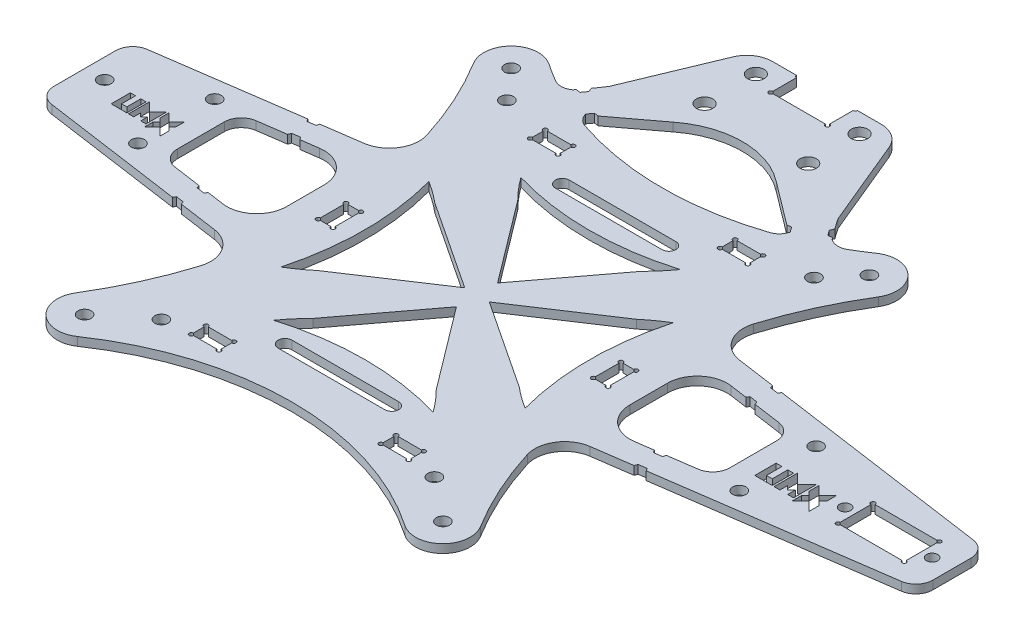
from build123d import *

# Parameters (mm, degrees)
SKETCH_1_R             = 1.55
SKETCH_1_R_2           = 1.3
SKETCH_1_W             = 6.5
SKETCH_1_H             = 3.5
SKETCH_1_W_2           = 3.5
SKETCH_1_H_2           = 6.5
SKETCH_1_W_3           = 15.5
SKETCH_1_H_3           = 8.2
EXTRUDE_1_DEPTH        = 2
FILLET_1_R             = 4
FILLET_2_R             = 7
SKETCH_4800_R          = 1.925
SKETCH_4800_R_2        = 1.55
EXTRUDE_2_DEPTH        = 2
CUT_EXTRUDE_7262_DEPTH = 139.317545525
SKETCH_10_R            = 0.5
CUT_EXTRUDE_7815_DEPTH = 139.317545525
FILLET_6_R             = 3.5
CUT_EXTRUDE_1_DEPTH    = 139.317545525


with BuildPart() as part:
    # 草图1 → 凸台-拉伸1 (new body)
    with BuildSketch(Plane(origin=(0, 0, 0), x_dir=(1, 0, 0), z_dir=(0, 1, 0))):
        with BuildLine():
            Line((111.35, 7.930343955), (111.35, -7.930343955))
            Line((111.35, -7.930343955), (36.25, -18.63611351))
            ThreePointArc((36.25, -18.63611351), (40.660213256, -33.120367866), (47.457481216, -46.649623332))
            ThreePointArc((47.457481216, -46.649623332), (46.417405741, -54.63634032), (38.389751701, -55.289161773))
            ThreePointArc((38.389751701, -55.289161773), (0, -43.436211003), (-38.389751701, -55.289161773))
            ThreePointArc((-38.389751701, -55.289161773), (-46.417405741, -54.63634032), (-47.457481216, -46.649623332))
            ThreePointArc((-47.457481216, -46.649623332), (-40.660213256, -33.120367866), (-36.25, -18.63611351))
            Line((-36.25, -18.63611351), (-91.953, -10.695454635))
            Line((-91.953, -10.695454635), (-91.953, 10.695454635))
            Line((-91.953, 10.695454635), (-36.25, 18.63611351))
            ThreePointArc((-36.25, 18.63611351), (-40.660213256, 33.120367866), (-47.457481216, 46.649623332))
            ThreePointArc((-47.457481216, 46.649623332), (-46.417405741, 54.63634032), (-38.389751701, 55.289161773))
            ThreePointArc((-38.389751701, 55.289161773), (0, 43.436211003), (38.389751701, 55.289161773))
            ThreePointArc((38.389751701, 55.289161773), (46.417405741, 54.63634032), (47.457481216, 46.649623332))
            ThreePointArc((47.457481216, 46.649623332), (40.660213256, 33.120367866), (36.25, 18.63611351))
            Line((36.25, 18.63611351), (111.35, 7.930343955))
        make_face()
        with Locations(Location((-36, 43, 0), (0, 0, 270))):
            Circle(SKETCH_1_R, mode=Mode.SUBTRACT)
        with Locations(Location((-32, -42, 0), (0, 0, 270))):
            Circle(SKETCH_1_R, mode=Mode.SUBTRACT)
        with Locations(Location((32, -42, 0), (0, 0, 90))):
            Circle(SKETCH_1_R, mode=Mode.SUBTRACT)
        with Locations(Location((36, 43, 0), (0, 0, 90))):
            Circle(SKETCH_1_R, mode=Mode.SUBTRACT)
        with Locations(Location((42, 50, 0), (0, 0, 270))):
            Circle(SKETCH_1_R, mode=Mode.SUBTRACT)
        with Locations(Location((42, -50, 0), (0, 0, 90))):
            Circle(SKETCH_1_R, mode=Mode.SUBTRACT)
        with Locations(Location((-42, -50, 0), (0, 0, 270))):
            Circle(SKETCH_1_R, mode=Mode.SUBTRACT)
        with Locations(Location((-42, 50, 0), (0, 0, 90))):
            Circle(SKETCH_1_R, mode=Mode.SUBTRACT)
        with Locations(Location((106.7, 0, 0), (0, 0, 270))):
            Circle(SKETCH_1_R_2, mode=Mode.SUBTRACT)
        with Locations(Location((86.3, 0, 0), (0, 0, 270))):
            Circle(SKETCH_1_R_2, mode=Mode.SUBTRACT)
        with Locations(Location((70.5, 9, 0), (0, 0, 270))):
            Circle(SKETCH_1_R, mode=Mode.SUBTRACT)
        with Locations(Location((70.5, -9, 0), (0, 0, 90))):
            Circle(SKETCH_1_R, mode=Mode.SUBTRACT)
        with Locations(Location((-70.5, -9, 0), (0, 0, 270))):
            Circle(SKETCH_1_R, mode=Mode.SUBTRACT)
        with Locations(Location((-70.5, 9, 0), (0, 0, 90))):
            Circle(SKETCH_1_R, mode=Mode.SUBTRACT)
        with Locations(Location((-87.3, 0, 0), (0, 0, 270))):
            Circle(SKETCH_1_R, mode=Mode.SUBTRACT)
        with Locations((-22.25, 39.75)):
            Rectangle(SKETCH_1_W, SKETCH_1_H, mode=Mode.SUBTRACT)
        with Locations((-32.25, 0)):
            Rectangle(SKETCH_1_W_2, SKETCH_1_H_2, mode=Mode.SUBTRACT)
        with Locations((-22.25, -39.75)):
            Rectangle(SKETCH_1_W, SKETCH_1_H, mode=Mode.SUBTRACT)
        with Locations((22.25, 39.75)):
            Rectangle(SKETCH_1_W, SKETCH_1_H, mode=Mode.SUBTRACT)
        with Locations((22.25, -39.75)):
            Rectangle(SKETCH_1_W, SKETCH_1_H, mode=Mode.SUBTRACT)
        with Locations((32.25, 0)):
            Rectangle(SKETCH_1_W_2, SKETCH_1_H_2, mode=Mode.SUBTRACT)
        with Locations((96.5, 0)):
            Rectangle(SKETCH_1_W_3, SKETCH_1_H_3, mode=Mode.SUBTRACT)
        with BuildLine():
            Line((14.429581723, 23.978041684), (0, 4.824748809))
            Line((0, 4.824748809), (-14.429581723, 23.978041684))
            ThreePointArc((-14.429581723, 23.978041684), (-16.659048595, 26.394459388), (-18.687147587, 28.982201943))
            ThreePointArc((-18.687147587, 28.982201943), (0, 26.269713534), (18.687147587, 28.982201943))
            ThreePointArc((18.687147587, 28.982201943), (16.659048595, 26.394459388), (14.429581723, 23.978041684))
        make_face(mode=Mode.SUBTRACT)
        with BuildLine():
            Line((23.625656004, -13.733041529), (2.87566363, 0))
            Line((2.87566363, 0), (23.625656004, 13.733041529))
            ThreePointArc((23.625656004, 13.733041529), (26.070594521, 15.638611076), (28.652877812, 17.35346753))
            ThreePointArc((28.652877812, 17.35346753), (26.34962019, 0), (28.652877812, -17.35346753))
            ThreePointArc((28.652877812, -17.35346753), (26.069043855, -15.640764287), (23.625656004, -13.733041529))
        make_face(mode=Mode.SUBTRACT)
        Polygon((-64.75, -8.96722955), (-64.75, 8.96722955), (-40.25, 12.459790856), (-40.25, -12.459790856), align=None, mode=Mode.SUBTRACT)
        Polygon((64.75, 8.96722955), (40.25, 12.459790856), (40.25, -12.459790856), (64.75, -8.96722955), align=None, mode=Mode.SUBTRACT)
        with BuildLine():
            Line((-23.625656004, 13.733041529), (-2.87566363, 0))
            Line((-2.87566363, 0), (-23.625656004, -13.733041529))
            ThreePointArc((-23.625656004, -13.733041529), (-26.069043855, -15.640764287), (-28.652877812, -17.35346753))
            ThreePointArc((-28.652877812, -17.35346753), (-26.34962019, 0), (-28.652877812, 17.35346753))
            ThreePointArc((-28.652877812, 17.35346753), (-26.070594521, 15.638611076), (-23.625656004, 13.733041529))
        make_face(mode=Mode.SUBTRACT)
        with BuildLine():
            Line((-14.429581723, -23.978041684), (0, -4.824748809))
            Line((0, -4.824748809), (14.429581723, -23.978041684))
            ThreePointArc((14.429581723, -23.978041684), (16.659048595, -26.394459388), (18.687147587, -28.982201943))
            ThreePointArc((18.687147587, -28.982201943), (0, -26.269713534), (-18.687147587, -28.982201943))
            ThreePointArc((-18.687147587, -28.982201943), (-16.659048595, -26.394459388), (-14.429581723, -23.978041684))
        make_face(mode=Mode.SUBTRACT)
        with BuildLine():
            Line((12.5, 30.875), (-12.5, 30.875))
            ThreePointArc((-12.5, 30.875), (-14.125, 32.5), (-12.5, 34.125))
            Line((-12.5, 34.125), (12.5, 34.125))
            ThreePointArc((12.5, 34.125), (14.125, 32.5), (12.5, 30.875))
        make_face(mode=Mode.SUBTRACT)
        with BuildLine():
            Line((12.5, -30.875), (-12.5, -30.875))
            ThreePointArc((-12.5, -30.875), (-14.125, -32.5), (-12.5, -34.125))
            Line((-12.5, -34.125), (12.5, -34.125))
            ThreePointArc((12.5, -34.125), (14.125, -32.5), (12.5, -30.875))
        make_face(mode=Mode.SUBTRACT)
    extrude(amount=EXTRUDE_1_DEPTH)

    # 圆角1
    fillet_1_edges = [part.edges().sort_by_distance(p)[0] for p in [
        (-64.75, 1, -8.96722955),
        (-64.75, 1, 8.96722955),
        (64.75, 1, 8.96722955),
        (64.75, 1, -8.96722955),
        (111.35, 1, -7.930343955),
        (111.35, 1, 7.930343955),
        (-91.953, 1, 10.695454635),
        (-91.953, 1, -10.695454635),
    ]]
    fillet(fillet_1_edges, radius=FILLET_1_R)

    # 圆角2
    fillet_2_edges = [part.edges().sort_by_distance(p)[0] for p in [
        (-40.25, 1, -12.459790856),
        (-40.25, 1, 12.459790856),
        (40.25, 1, -12.459790856),
        (40.25, 1, 12.459790856),
        (-36.25, 1, -18.63611351),
        (36.25, 1, -18.63611351),
        (36.25, 1, 18.63611351),
        (-36.25, 1, 18.63611351),
    ]]
    fillet(fillet_2_edges, radius=FILLET_2_R)

    # Sketch 4800 → 凸台-拉伸2 (add)
    with BuildSketch(Plane(origin=(0, 0, 0), x_dir=(1, 0, 0), z_dir=(0, 1, 0))):
        with BuildLine():
            Line((30.40246304, 52.857720294), (32.037278544, 51.028700347))
            ThreePointArc((32.037278544, 51.028700347), (34.725061467, 48.527352956), (37.824815498, 46.559501145))
            ThreePointArc((37.824815498, 46.559501145), (38.771413552, 40.115686057), (32.370509151, 41.318692124))
            ThreePointArc((32.370509151, 41.318692124), (31.135199663, 43.325028618), (29.464750167, 44.986646546))
            Line((29.464750167, 44.986646546), (12.079037765, 58.081112652))
            ThreePointArc((12.079037765, 58.081112652), (0, 62.25), (-12.079037765, 58.081112652))
            Line((-12.079037765, 58.081112652), (-29.464750167, 44.986646546))
            ThreePointArc((-29.464750167, 44.986646546), (-31.135199663, 43.325028618), (-32.370509151, 41.318692124))
            ThreePointArc((-32.370509151, 41.318692124), (-38.771413552, 40.115686057), (-37.824815498, 46.559501145))
            ThreePointArc((-37.824815498, 46.559501145), (-34.725061467, 48.527352956), (-32.037278544, 51.028700347))
            Line((-32.037278544, 51.028700347), (-30.40246304, 52.857720294))
            ThreePointArc((-30.40246304, 52.857720294), (-28.566741169, 55.316872195), (-26.826684448, 57.844619308))
            Line((-26.826684448, 57.844619308), (-18.332213608, 78.301443779))
            ThreePointArc((-18.332213608, 78.301443779), (-16.104557569, 81.012221263), (-12.746746908, 82.03))
            Line((-12.746746908, 82.03), (-6.65, 82.03))
            Line((-6.65, 82.03), (-6.65, 75.53))
            Line((-6.65, 75.53), (-0.15, 75.53))
            Line((-0.15, 75.53), (0.15, 75.53))
            Line((0.15, 75.53), (6.65, 75.53))
            Line((6.65, 75.53), (6.65, 82.03))
            Line((6.65, 82.03), (12.746746908, 82.03))
            ThreePointArc((12.746746908, 82.03), (16.104557569, 81.012221263), (18.332213608, 78.301443779))
            Line((18.332213608, 78.301443779), (26.826684448, 57.844619308))
            ThreePointArc((26.826684448, 57.844619308), (28.566741169, 55.316872195), (30.40246304, 52.857720294))
        make_face()
        with Locations(Location((-12.15, 77.53, 0), (0, 0, 270))):
            Circle(SKETCH_4800_R, mode=Mode.SUBTRACT)
        with Locations(Location((-12.15, 65.5, 0), (0, 0, 270))):
            Circle(SKETCH_4800_R, mode=Mode.SUBTRACT)
        with Locations(Location((12.15, 65.5, 0), (0, 0, 270))):
            Circle(SKETCH_4800_R, mode=Mode.SUBTRACT)
        with Locations(Location((12.15, 77.53, 0), (0, 0, 270))):
            Circle(SKETCH_4800_R, mode=Mode.SUBTRACT)
        with Locations(Location((-36, 43, 0), (0, 0, 270))):
            Circle(SKETCH_4800_R_2, mode=Mode.SUBTRACT)
        with Locations(Location((36, 43, 0), (0, 0, 90))):
            Circle(SKETCH_4800_R_2, mode=Mode.SUBTRACT)
    extrude(amount=EXTRUDE_2_DEPTH)

    # Sketch 6287 → Cut-Extrude 7262 (cut, through all)
    with BuildSketch(Plane(origin=(0, 0, 0), x_dir=(1, 0, 0), z_dir=(0, 1, 0))):
        Polygon((54.567863287, 11.07530028), (52.693017281, 11.342566183), (52.301218463, 10.741847212), (54.776197291, 10.389030261), align=None)
        Polygon((53.292806097, 15.550030191), (53.084472093, 16.23630021), (55.559450921, 15.883483259), (55.167652103, 15.282764288), align=None)
        Polygon((-55.167652103, 15.282764288), (-53.292806097, 15.550030191), (-53.084472093, 16.23630021), (-55.559450921, 15.883483259), align=None)
        Polygon((-52.693017281, 11.342566183), (-52.301218463, 10.741847212), (-54.776197291, 10.389030261), (-54.567863287, 11.07530028), align=None)
        Polygon((-54.567863287, -11.07530028), (-52.693017281, -11.342566183), (-52.301218463, -10.741847212), (-54.776197291, -10.389030261), align=None)
        Polygon((-53.292806097, -15.550030191), (-53.084472093, -16.23630021), (-55.559450921, -15.883483259), (-55.167652103, -15.282764288), align=None)
        Polygon((55.167652103, -15.282764288), (53.292806097, -15.550030191), (53.084472093, -16.23630021), (55.559450921, -15.883483259), align=None)
        Polygon((52.693017281, -11.342566183), (52.301218463, -10.741847212), (54.776197291, -10.389030261), (54.567863287, -11.07530028), align=None)
        with BuildLine():
            Line((28.566741169, 55.316872195), (28.171854036, 54.398142555))
            Line((28.171854036, 54.398142555), (29.055099499, 53.197206825))
            Line((29.055099499, 53.197206825), (30.055099499, 53.308193654))
            ThreePointArc((30.055099499, 53.308193654), (29.303073455, 54.30671867), (28.566741169, 55.316872195))
        make_face()
        Polygon((23.59345449, 48.522024611), (22.106700313, 50.528538198), (23.106700313, 50.643129978), (23.994215097, 49.445345905), align=None)
        Polygon((-23.994215097, 49.445345905), (-23.59345449, 48.522024611), (-22.106700313, 50.528538198), (-23.106700313, 50.643129978), align=None)
        with BuildLine():
            Line((-29.055099499, 53.197206825), (-30.055099499, 53.308193654))
            ThreePointArc((-30.055099499, 53.308193654), (-29.303073455, 54.30671867), (-28.566741169, 55.316872195))
            Line((-28.566741169, 55.316872195), (-28.171854036, 54.398142555))
            Line((-28.171854036, 54.398142555), (-29.055099499, 53.197206825))
        make_face()
    extrude(amount=CUT_EXTRUDE_7262_DEPTH, mode=Mode.SUBTRACT)

    # 草图10 → Cut-Extrude 7815 (cut, through all)
    with BuildSketch(Plane(origin=(0, 0, 0), x_dir=(1, 0, 0), z_dir=(0, 1, 0))):
        with Locations((-25.5, 41.5)):
            Circle(SKETCH_10_R)
        with Locations((-19, 41.5)):
            Circle(SKETCH_10_R)
        with Locations((-25.5, 38)):
            Circle(SKETCH_10_R)
        with Locations((-19, 38)):
            Circle(SKETCH_10_R)
        with Locations((-34, 3.25)):
            Circle(SKETCH_10_R)
        with Locations((-30.5, 3.25)):
            Circle(SKETCH_10_R)
        with Locations((-34, -3.25)):
            Circle(SKETCH_10_R)
        with Locations((-30.5, -3.25)):
            Circle(SKETCH_10_R)
        with Locations((-25.5, -38)):
            Circle(SKETCH_10_R)
        with Locations((-19, -38)):
            Circle(SKETCH_10_R)
        with Locations((-25.5, -41.5)):
            Circle(SKETCH_10_R)
        with Locations((-19, -41.5)):
            Circle(SKETCH_10_R)
        with Locations((19, -41.5)):
            Circle(SKETCH_10_R)
        with Locations((25.5, -41.5)):
            Circle(SKETCH_10_R)
        with Locations((19, -38)):
            Circle(SKETCH_10_R)
        with Locations((25.5, -38)):
            Circle(SKETCH_10_R)
        with Locations((30.5, -3.25)):
            Circle(SKETCH_10_R)
        with Locations((34, -3.25)):
            Circle(SKETCH_10_R)
        with Locations((30.5, 3.25)):
            Circle(SKETCH_10_R)
        with Locations((34, 3.25)):
            Circle(SKETCH_10_R)
        with Locations((19, 38)):
            Circle(SKETCH_10_R)
        with Locations((25.5, 38)):
            Circle(SKETCH_10_R)
        with Locations((19, 41.5)):
            Circle(SKETCH_10_R)
        with Locations((25.5, 41.5)):
            Circle(SKETCH_10_R)
        with Locations((88.75, 4.1)):
            Circle(SKETCH_10_R)
        with Locations((104.25, 4.1)):
            Circle(SKETCH_10_R)
        with Locations((88.75, -4.1)):
            Circle(SKETCH_10_R)
        with Locations((104.25, -4.1)):
            Circle(SKETCH_10_R)
        with Locations((-6.65, 75.53)):
            Circle(SKETCH_10_R)
        with Locations((6.65, 75.53)):
            Circle(SKETCH_10_R)
        with Locations((-6.65, 82.03)):
            Circle(SKETCH_10_R)
        with Locations((6.65, 82.03)):
            Circle(SKETCH_10_R)
    extrude(amount=CUT_EXTRUDE_7815_DEPTH, mode=Mode.SUBTRACT)

    # 圆角6
    # the kernel refuses this fillet: 3.5 mm, written as the material it adds along each edge
    with BuildSketch(Plane(origin=(31.785860953, 2, -51.309984558), x_dir=(0.8746378284916945, 0, -0.4847769270203906), z_dir=(0, -1, 0))) as fillet_6_piece_1:
        with BuildLine():
            CenterArc((2.714387201, -3.499267607), FILLET_6_R, 88.827850014, 66.248782114)
            Line((-0.459665573, -2.024347612), (-0.523146628, -1.994849212))
            ThreePointArc((-0.523146628, -1.994849212), (-0.298095098, -0.996673586), (-0.068262311, 0.015500221))
            Line((-0.068262311, 0.015500221), (-0.001431951, 0.069985352))
            ThreePointArc((-0.001431951, 0.069985352), (1.392992387, 0.08424933), (2.787416726, 0.069985352))
            Line((2.787416726, 0.069985352), (2.785984774, 0))
        make_face()
    extrude(amount=2)
    with BuildSketch(Plane(origin=(25.13749424, 2, -48.245823091), x_dir=(-0.798781404888274, 0, -0.6016213653160227), z_dir=(0, -1, 0))) as fillet_6_piece_2:
        with BuildLine():
            CenterArc((4.887832594, -1.114060576), FILLET_6_R, 161.439670172, 53.012025039)
            Line((2.001720623, -3.094049893), (1.943998384, -3.133649679))
            ThreePointArc((1.943998384, -3.133649679), (0.921153869, -1.598591674), (-0.059779944, -0.036419202))
            Line((-0.059779944, -0.036419202), (0, 0.07))
            ThreePointArc((0, 0.07), (0.784935508, 0.07), (1.503511784, 0.022281212))
            Line((1.503511784, 0.022281212), (1.569871015, 0))
        make_face()
    extrude(amount=2)
    with BuildSketch(Plane(origin=(-31.785860953, 2, -51.309984558), x_dir=(0.6664153260334111, 0, -0.7455807221406562), z_dir=(0, -1, 0))) as fillet_6_piece_3:
        with BuildLine():
            CenterArc((2.811349927, -3.421853774), FILLET_6_R, 102.130229018, 66.248782114)
            Line((-0.616905407, -2.716825147), (-0.685470514, -2.702724575))
            ThreePointArc((-0.685470514, -2.702724575), (-0.390610618, -1.339757099), (-0.067930948, 0.016893382))
            Line((-0.067930948, 0.016893382), (0, 0.07))
            ThreePointArc((0, 0.07), (1.037939749, 0.07), (2.06117009, 0.068437075))
            Line((2.06117009, 0.068437075), (2.075879499, 0))
        make_face()
    extrude(amount=2)
    with BuildSketch(Plane(origin=(-25.13749424, 2, -48.245823091), x_dir=(0.9390179494642213, 0, 0.3438681296427588), z_dir=(0, -1, 0))) as fillet_6_piece_4:
        with BuildLine():
            CenterArc((3.5904049, -3.498718492), FILLET_6_R, 88.449479434, 53.012025039)
            Line((0.852740848, -1.318077407), (0.797987567, -1.274464586))
            ThreePointArc((0.797987567, -1.274464586), (0.367597813, -0.69706212), (-0.058772611, -0.038023416))
            Line((-0.058772611, -0.038023416), (-0.001894087, 0.06997437))
            ThreePointArc((-0.001894087, 0.06997437), (1.842554625, 0.094932842), (3.687003338, 0.06997437))
            Line((3.687003338, 0.06997437), (3.685109251, 0))
        make_face()
    extrude(amount=2)

    # Sketch 8448 → 切除-拉伸1 (cut, through all)
    with BuildSketch(Plane(origin=(0, 0, 0), x_dir=(1, 0, 0), z_dir=(0, 1, 0))):
        Polygon((82.884100026, -5.009090909), (82.884100026, -2.736363636), (81.975009117, -1.827272727), (82.884100026, -0.918181818), (82.884100026, 1.354545455), (80.83864548, -0.690909091), (78.793190935, 1.354545455), (78.793190935, -0.918181818), (79.702281844, -1.827272727), (78.793190935, -2.736363636), (78.793190935, -5.009090909), (80.83864548, -2.963636364), align=None)
        Polygon((78.304975447, -4.1), (78.304975447, 1.354545455), (76.032248174, -0.918181818), (73.759520901, 1.354545455), (73.759520901, -4.1), (75.123157265, -4.1), (75.123157265, -2.281818182), (76.032248174, -3.190909091), (76.941339083, -2.281818182), (76.941339083, -4.1), align=None)
        Polygon((73.321810464, -4.1), (73.321810464, 0.9), (71.9581741, 0.9), (71.9581741, -2.736363636), (70.594537736, -2.736363636), (70.594537736, 0.9), (69.230901373, 0.9), (69.230901373, -4.1), align=None)
        Polygon((-69.39511358, -4.918181818), (-69.39511358, -2.872727273), (-70.213295398, -2.054545455), (-69.39511358, -1.236363636), (-69.39511358, 0.809090909), (-71.236022671, -1.031818182), (-73.076931762, 0.809090909), (-73.076931762, -1.236363636), (-72.258749944, -2.054545455), (-73.076931762, -2.872727273), (-73.076931762, -4.918181818), (-71.236022671, -3.077272727), align=None)
        Polygon((-73.516325701, -4.1), (-73.516325701, 0.809090909), (-75.561780247, -1.236363636), (-77.607234792, 0.809090909), (-77.607234792, -4.1), (-76.379962065, -4.1), (-76.379962065, -2.463636364), (-75.561780247, -3.281818182), (-74.743598429, -2.463636364), (-74.743598429, -4.1), align=None)
        Polygon((-78.001174186, -4.1), (-78.001174186, 0.4), (-79.228446914, 0.4), (-79.228446914, -2.872727273), (-80.455719641, -2.872727273), (-80.455719641, 0.4), (-81.682992368, 0.4), (-81.682992368, -4.1), align=None)
    extrude(amount=CUT_EXTRUDE_1_DEPTH, mode=Mode.SUBTRACT)


solid = part.part
